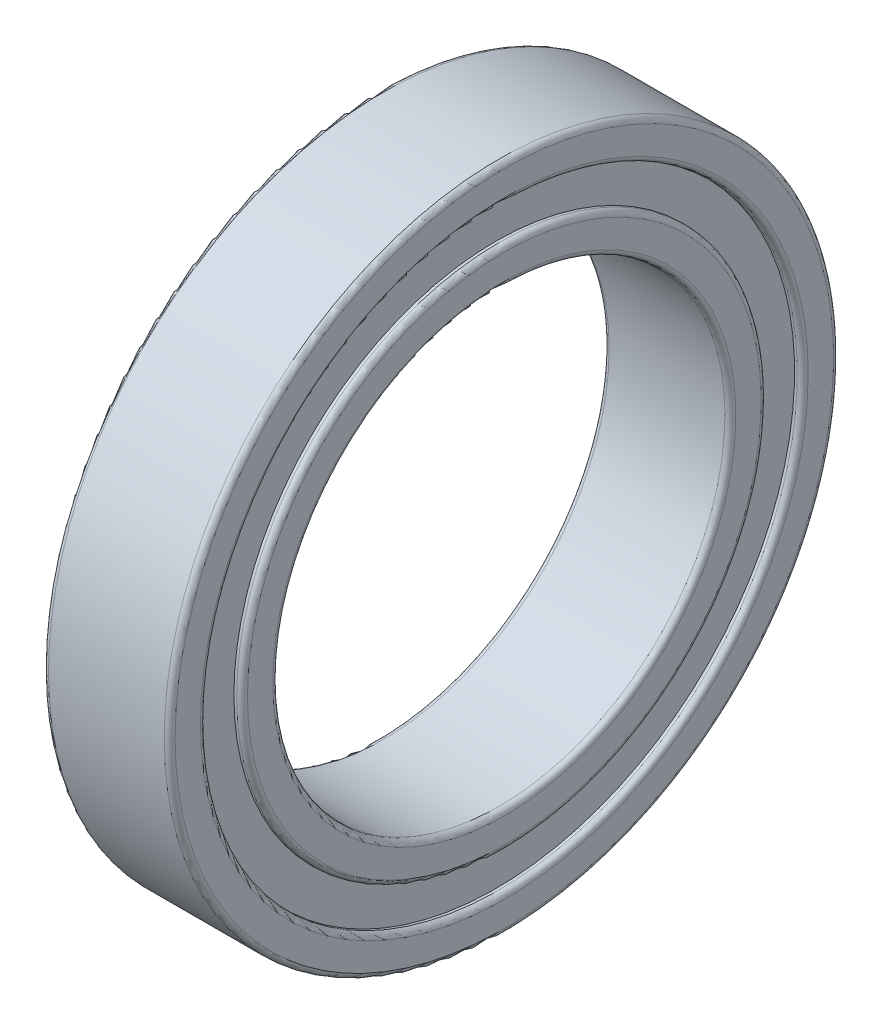
from build123d import *
from build123d.topology import SkipClean

# Parameters (mm, degrees)
SKETCH_5_W               = 0.8999999999999997
SKETCH_5_H               = 0.6000000000000014
PATTERN_CIRCULAR_5_COUNT = 26
PATTERN_CIRCULAR_2_COUNT = 26
SKETCH_8_W               = 0.30000000000000027
SKETCH_8_H               = 2.6000000000000014
SKETCH_8_W_2             = 0.2999999999999998


with BuildPart() as part:
    # 草图2 → 旋转1 (revolve)
    with BuildSketch(Plane.XY):
        with BuildLine():
            Line((3.2000000000000015, 12.500000000000004), (-3.2000000000000006, 12.500000000000004))
            ThreePointArc((-3.2000000000000006, 12.500000000000004), (-3.4121320343559653, 12.58786796564404), (-3.5000000000000013, 12.800000000000006))
            Line((-3.5000000000000013, 12.800000000000006), (-3.5000000000000013, 14.200000000000019))
            ThreePointArc((-3.5000000000000013, 14.200000000000019), (-3.412132034355964, 14.41213203435598), (-3.2000000000000015, 14.500000000000012))
            Line((-3.2000000000000015, 14.500000000000012), (-1.1180339887499022, 14.500000000000012))
            ThreePointArc((-1.1180339887499022, 14.500000000000012), (2.29e-15, 13.999999999999998), (1.1180339887499022, 14.500000000000012))
            Line((1.1180339887499022, 14.500000000000012), (3.2000000000000015, 14.500000000000012))
            ThreePointArc((3.2000000000000015, 14.500000000000012), (3.4121320343559667, 14.412132034355977), (3.500000000000003, 14.200000000000012))
            Line((3.500000000000003, 14.200000000000012), (3.500000000000003, 12.800000000000006))
            ThreePointArc((3.500000000000003, 12.800000000000006), (3.4121320343559676, 12.58786796564404), (3.2000000000000015, 12.500000000000004))
        make_face()
        with BuildLine():
            Line((-3.4999999999999996, 18.199999999999996), (-3.499999999999998, 16.799999999999997))
            ThreePointArc((-3.499999999999998, 16.799999999999997), (-3.412132034355961, 16.587867965644037), (-3.199999999999998, 16.5))
            Line((-3.199999999999998, 16.5), (-1.1180339887498894, 16.5))
            ThreePointArc((-1.1180339887498894, 16.5), (2.29e-15, 16.999999999999993), (1.1180339887498894, 16.5))
            Line((1.1180339887498894, 16.5), (3.1999999999999997, 16.5))
            ThreePointArc((3.1999999999999997, 16.5), (3.4121320343559645, 16.587867965644037), (3.5000000000000013, 16.8))
            Line((3.5000000000000013, 16.8), (3.5000000000000013, 18.2))
            ThreePointArc((3.5000000000000013, 18.2), (3.412132034355966, 18.412132034355963), (3.2000000000000015, 18.500000000000004))
            Line((3.2000000000000015, 18.500000000000004), (-3.1999999999999997, 18.500000000000004))
            ThreePointArc((-3.1999999999999997, 18.500000000000004), (-3.4121320343559676, 18.412132034355967), (-3.4999999999999996, 18.199999999999996))
        make_face()
    revolve(axis=Axis((-3.4999999999999996, 0, 0), (1, 0, 0)))


with BuildPart() as body_2:
    # 草图5 → 旋转3 (revolve)
    with BuildSketch(Plane.XY):
        with Locations((2.03e-15, 15.5)):
            Rectangle(SKETCH_5_W, SKETCH_5_H)
    revolve(axis=Axis((-19.927092192426834, 0, 0), (1, 0, 0)))



with BuildPart() as body_3:
    # 草图3 → 旋转2 (revolve)
    with BuildSketch(Plane.XY):
        with BuildLine():
            ThreePointArc((1.6499999999999924, 15.5), (-3.2e-16, 17.149999999999988), (-1.6499999999999928, 15.5))
            Line((-1.6499999999999935, 15.5), (1.6499999999999935, 15.5))
        make_face()
    revolve(axis=Axis((-1.6499999999999935, 15.5, 0), (1, 0, 0)))


with BuildPart() as pattern_circular_5_1:
    # 阵列(圆周)5: pattern copy
    add(body_3.part.rotate(Axis((-13.200000000000006, 0, 0), (1, 0, 0)), 1 * 360 / PATTERN_CIRCULAR_5_COUNT))


with BuildPart() as pattern_circular_5_2:
    # 阵列(圆周)5: pattern copy
    add(body_3.part.rotate(Axis((-13.200000000000006, 0, 0), (1, 0, 0)), 2 * 360 / PATTERN_CIRCULAR_5_COUNT))


with BuildPart() as pattern_circular_5_3:
    # 阵列(圆周)5: pattern copy
    add(body_3.part.rotate(Axis((-13.200000000000006, 0, 0), (1, 0, 0)), 3 * 360 / PATTERN_CIRCULAR_5_COUNT))


with BuildPart() as pattern_circular_5_4:
    # 阵列(圆周)5: pattern copy
    add(body_3.part.rotate(Axis((-13.200000000000006, 0, 0), (1, 0, 0)), 4 * 360 / PATTERN_CIRCULAR_5_COUNT))


with BuildPart() as pattern_circular_5_5:
    # 阵列(圆周)5: pattern copy
    add(body_3.part.rotate(Axis((-13.200000000000006, 0, 0), (1, 0, 0)), 5 * 360 / PATTERN_CIRCULAR_5_COUNT))


with BuildPart() as pattern_circular_5_6:
    # 阵列(圆周)5: pattern copy
    add(body_3.part.rotate(Axis((-13.200000000000006, 0, 0), (1, 0, 0)), 6 * 360 / PATTERN_CIRCULAR_5_COUNT))


with BuildPart() as pattern_circular_5_7:
    # 阵列(圆周)5: pattern copy
    add(body_3.part.rotate(Axis((-13.200000000000006, 0, 0), (1, 0, 0)), 7 * 360 / PATTERN_CIRCULAR_5_COUNT))


with BuildPart() as pattern_circular_5_8:
    # 阵列(圆周)5: pattern copy
    add(body_3.part.rotate(Axis((-13.200000000000006, 0, 0), (1, 0, 0)), 8 * 360 / PATTERN_CIRCULAR_5_COUNT))


with BuildPart() as pattern_circular_5_9:
    # 阵列(圆周)5: pattern copy
    add(body_3.part.rotate(Axis((-13.200000000000006, 0, 0), (1, 0, 0)), 9 * 360 / PATTERN_CIRCULAR_5_COUNT))


with BuildPart() as pattern_circular_5_10:
    # 阵列(圆周)5: pattern copy
    add(body_3.part.rotate(Axis((-13.200000000000006, 0, 0), (1, 0, 0)), 10 * 360 / PATTERN_CIRCULAR_5_COUNT))


with BuildPart() as pattern_circular_5_11:
    # 阵列(圆周)5: pattern copy
    add(body_3.part.rotate(Axis((-13.200000000000006, 0, 0), (1, 0, 0)), 11 * 360 / PATTERN_CIRCULAR_5_COUNT))


with BuildPart() as pattern_circular_5_12:
    # 阵列(圆周)5: pattern copy
    add(body_3.part.rotate(Axis((-13.200000000000006, 0, 0), (1, 0, 0)), 12 * 360 / PATTERN_CIRCULAR_5_COUNT))


with BuildPart() as pattern_circular_5_13:
    # 阵列(圆周)5: pattern copy
    add(body_3.part.rotate(Axis((-13.200000000000006, 0, 0), (1, 0, 0)), 13 * 360 / PATTERN_CIRCULAR_5_COUNT))


with BuildPart() as pattern_circular_5_14:
    # 阵列(圆周)5: pattern copy
    add(body_3.part.rotate(Axis((-13.200000000000006, 0, 0), (1, 0, 0)), 14 * 360 / PATTERN_CIRCULAR_5_COUNT))


with BuildPart() as pattern_circular_5_15:
    # 阵列(圆周)5: pattern copy
    add(body_3.part.rotate(Axis((-13.200000000000006, 0, 0), (1, 0, 0)), 15 * 360 / PATTERN_CIRCULAR_5_COUNT))


with BuildPart() as pattern_circular_5_16:
    # 阵列(圆周)5: pattern copy
    add(body_3.part.rotate(Axis((-13.200000000000006, 0, 0), (1, 0, 0)), 16 * 360 / PATTERN_CIRCULAR_5_COUNT))


with BuildPart() as pattern_circular_5_17:
    # 阵列(圆周)5: pattern copy
    add(body_3.part.rotate(Axis((-13.200000000000006, 0, 0), (1, 0, 0)), 17 * 360 / PATTERN_CIRCULAR_5_COUNT))


with BuildPart() as pattern_circular_5_18:
    # 阵列(圆周)5: pattern copy
    add(body_3.part.rotate(Axis((-13.200000000000006, 0, 0), (1, 0, 0)), 18 * 360 / PATTERN_CIRCULAR_5_COUNT))


with BuildPart() as pattern_circular_5_19:
    # 阵列(圆周)5: pattern copy
    add(body_3.part.rotate(Axis((-13.200000000000006, 0, 0), (1, 0, 0)), 19 * 360 / PATTERN_CIRCULAR_5_COUNT))


with BuildPart() as pattern_circular_5_20:
    # 阵列(圆周)5: pattern copy
    add(body_3.part.rotate(Axis((-13.200000000000006, 0, 0), (1, 0, 0)), 20 * 360 / PATTERN_CIRCULAR_5_COUNT))


with BuildPart() as pattern_circular_5_21:
    # 阵列(圆周)5: pattern copy
    add(body_3.part.rotate(Axis((-13.200000000000006, 0, 0), (1, 0, 0)), 21 * 360 / PATTERN_CIRCULAR_5_COUNT))


with BuildPart() as pattern_circular_5_22:
    # 阵列(圆周)5: pattern copy
    add(body_3.part.rotate(Axis((-13.200000000000006, 0, 0), (1, 0, 0)), 22 * 360 / PATTERN_CIRCULAR_5_COUNT))


with BuildPart() as pattern_circular_5_23:
    # 阵列(圆周)5: pattern copy
    add(body_3.part.rotate(Axis((-13.200000000000006, 0, 0), (1, 0, 0)), 23 * 360 / PATTERN_CIRCULAR_5_COUNT))


with BuildPart() as pattern_circular_5_24:
    # 阵列(圆周)5: pattern copy
    add(body_3.part.rotate(Axis((-13.200000000000006, 0, 0), (1, 0, 0)), 24 * 360 / PATTERN_CIRCULAR_5_COUNT))


with BuildPart() as pattern_circular_5_25:
    # 阵列(圆周)5: pattern copy
    add(body_3.part.rotate(Axis((-13.200000000000006, 0, 0), (1, 0, 0)), 25 * 360 / PATTERN_CIRCULAR_5_COUNT))


with BuildPart() as cut_revolve_1_tool:
    # 草图6 → 切除-旋转1 (revolve)
    with BuildSketch(Plane.XY):
        with BuildLine():
            Line((-1.6224980739587886, 15.8), (1.6224980739587886, 15.8))
            ThreePointArc((1.6224980739587886, 15.8), (4.83e-15, 17.149999999999988), (-1.6224980739587886, 15.8))
        make_face()
        with BuildLine():
            Line((-1.6224980739587886, 15.199999999999998), (1.6224980739587886, 15.199999999999998))
            ThreePointArc((1.6224980739587886, 15.199999999999998), (5.2e-15, 13.85), (-1.6224980739587886, 15.199999999999998))
        make_face()
    revolve(axis=Axis((-19.927092192426834, 0, 0), (1, 0, 0)))


with BuildPart() as part_1:
    add(part.part)

    # 切除-旋转1: cut by cut_revolve_1_tool
    add(cut_revolve_1_tool.part, mode=Mode.SUBTRACT)

    # 草图8 → 旋转5 (revolve)
    with BuildSketch(Plane.XY):
        with Locations((2.900000000000003, 15.5)):
            Rectangle(SKETCH_8_W, SKETCH_8_H)
        with Locations((-2.8999999999999884, 15.5)):
            Rectangle(SKETCH_8_W_2, SKETCH_8_H)
    revolve(axis=Axis((-19.927092192426834, 0, 0), (1, 0, 0)))


with BuildPart() as body_3_1:
    add(body_3.part)

    # 切除-旋转1: cut by cut_revolve_1_tool
    add(cut_revolve_1_tool.part, mode=Mode.SUBTRACT)


with BuildPart() as pattern_circular_5_1_1:
    add(pattern_circular_5_1.part)

    # 切除-旋转1: cut by cut_revolve_1_tool
    add(cut_revolve_1_tool.part, mode=Mode.SUBTRACT)


with BuildPart() as pattern_circular_5_2_1:
    add(pattern_circular_5_2.part)

    # 切除-旋转1: cut by cut_revolve_1_tool
    add(cut_revolve_1_tool.part, mode=Mode.SUBTRACT)


with BuildPart() as pattern_circular_5_3_1:
    add(pattern_circular_5_3.part)

    # 切除-旋转1: cut by cut_revolve_1_tool
    add(cut_revolve_1_tool.part, mode=Mode.SUBTRACT)


with BuildPart() as pattern_circular_5_4_1:
    add(pattern_circular_5_4.part)

    # 切除-旋转1: cut by cut_revolve_1_tool
    add(cut_revolve_1_tool.part, mode=Mode.SUBTRACT)


with BuildPart() as pattern_circular_5_5_1:
    add(pattern_circular_5_5.part)

    # 切除-旋转1: cut by cut_revolve_1_tool
    add(cut_revolve_1_tool.part, mode=Mode.SUBTRACT)


with BuildPart() as pattern_circular_5_6_1:
    add(pattern_circular_5_6.part)

    # 切除-旋转1: cut by cut_revolve_1_tool
    add(cut_revolve_1_tool.part, mode=Mode.SUBTRACT)


with BuildPart() as pattern_circular_5_7_1:
    add(pattern_circular_5_7.part)

    # 切除-旋转1: cut by cut_revolve_1_tool
    add(cut_revolve_1_tool.part, mode=Mode.SUBTRACT)


with BuildPart() as pattern_circular_5_8_1:
    add(pattern_circular_5_8.part)

    # 切除-旋转1: cut by cut_revolve_1_tool
    add(cut_revolve_1_tool.part, mode=Mode.SUBTRACT)


with BuildPart() as pattern_circular_5_9_1:
    add(pattern_circular_5_9.part)

    # 切除-旋转1: cut by cut_revolve_1_tool
    add(cut_revolve_1_tool.part, mode=Mode.SUBTRACT)


with BuildPart() as pattern_circular_5_10_1:
    add(pattern_circular_5_10.part)

    # 切除-旋转1: cut by cut_revolve_1_tool
    add(cut_revolve_1_tool.part, mode=Mode.SUBTRACT)


with BuildPart() as pattern_circular_5_11_1:
    add(pattern_circular_5_11.part)

    # 切除-旋转1: cut by cut_revolve_1_tool
    add(cut_revolve_1_tool.part, mode=Mode.SUBTRACT)


with BuildPart() as pattern_circular_5_12_1:
    add(pattern_circular_5_12.part)

    # 切除-旋转1: cut by cut_revolve_1_tool
    add(cut_revolve_1_tool.part, mode=Mode.SUBTRACT)


with BuildPart() as pattern_circular_5_13_1:
    add(pattern_circular_5_13.part)

    # 切除-旋转1: cut by cut_revolve_1_tool
    add(cut_revolve_1_tool.part, mode=Mode.SUBTRACT)


with BuildPart() as pattern_circular_5_14_1:
    add(pattern_circular_5_14.part)

    # 切除-旋转1: cut by cut_revolve_1_tool
    add(cut_revolve_1_tool.part, mode=Mode.SUBTRACT)


with BuildPart() as pattern_circular_5_15_1:
    add(pattern_circular_5_15.part)

    # 切除-旋转1: cut by cut_revolve_1_tool
    add(cut_revolve_1_tool.part, mode=Mode.SUBTRACT)


with BuildPart() as pattern_circular_5_16_1:
    add(pattern_circular_5_16.part)

    # 切除-旋转1: cut by cut_revolve_1_tool
    add(cut_revolve_1_tool.part, mode=Mode.SUBTRACT)


with BuildPart() as pattern_circular_5_17_1:
    add(pattern_circular_5_17.part)

    # 切除-旋转1: cut by cut_revolve_1_tool
    add(cut_revolve_1_tool.part, mode=Mode.SUBTRACT)


with BuildPart() as pattern_circular_5_18_1:
    add(pattern_circular_5_18.part)

    # 切除-旋转1: cut by cut_revolve_1_tool
    add(cut_revolve_1_tool.part, mode=Mode.SUBTRACT)


with BuildPart() as pattern_circular_5_19_1:
    add(pattern_circular_5_19.part)

    # 切除-旋转1: cut by cut_revolve_1_tool
    add(cut_revolve_1_tool.part, mode=Mode.SUBTRACT)


with BuildPart() as pattern_circular_5_20_1:
    add(pattern_circular_5_20.part)

    # 切除-旋转1: cut by cut_revolve_1_tool
    add(cut_revolve_1_tool.part, mode=Mode.SUBTRACT)


with BuildPart() as pattern_circular_5_21_1:
    add(pattern_circular_5_21.part)

    # 切除-旋转1: cut by cut_revolve_1_tool
    add(cut_revolve_1_tool.part, mode=Mode.SUBTRACT)


with BuildPart() as pattern_circular_5_22_1:
    add(pattern_circular_5_22.part)

    # 切除-旋转1: cut by cut_revolve_1_tool
    add(cut_revolve_1_tool.part, mode=Mode.SUBTRACT)


with BuildPart() as pattern_circular_5_23_1:
    add(pattern_circular_5_23.part)

    # 切除-旋转1: cut by cut_revolve_1_tool
    add(cut_revolve_1_tool.part, mode=Mode.SUBTRACT)


with BuildPart() as pattern_circular_5_24_1:
    add(pattern_circular_5_24.part)

    # 切除-旋转1: cut by cut_revolve_1_tool
    add(cut_revolve_1_tool.part, mode=Mode.SUBTRACT)


with BuildPart() as pattern_circular_5_25_1:
    add(pattern_circular_5_25.part)

    # 切除-旋转1: cut by cut_revolve_1_tool
    add(cut_revolve_1_tool.part, mode=Mode.SUBTRACT)


with BuildPart() as body_2_1:
    with SkipClean():  # the faces are left unmerged after this step: merging them gives an invalid solid
        add(body_2.part)

        add(body_3_1.part)  # 旋转4 merges body 3
        # 草图7 → 旋转4 (revolve)
        with BuildSketch(Plane.XY):
            with BuildLine():
                Line((-1.4999999999999953, 15.5), (1.4999999999999953, 15.5))
                ThreePointArc((1.4999999999999953, 15.5), (6.29e-15, 16.99999999999999), (-1.4999999999999953, 15.5))
            make_face()
        revolve_4 = revolve(axis=Axis((-1.4999999999999953, 15.5, 0), (1, 0, 0)))

    # 阵列(圆周)2: 旋转4 ×26 about axis
    with SkipClean():  # the faces are left unmerged after this step: merging them gives an invalid solid
        pattern_circular_2_axis = Axis((-13.200000000000006, 0, 0), (1, 0, 0))
        for i in range(1, PATTERN_CIRCULAR_2_COUNT):
            add(revolve_4.rotate(pattern_circular_2_axis, i * 360 / PATTERN_CIRCULAR_2_COUNT))


solid = Compound([part_1.part, pattern_circular_5_1_1.part, pattern_circular_5_2_1.part, pattern_circular_5_3_1.part, pattern_circular_5_4_1.part, pattern_circular_5_5_1.part, pattern_circular_5_6_1.part, pattern_circular_5_7_1.part, pattern_circular_5_8_1.part, pattern_circular_5_9_1.part, pattern_circular_5_10_1.part, pattern_circular_5_11_1.part, pattern_circular_5_12_1.part, pattern_circular_5_13_1.part, pattern_circular_5_14_1.part, pattern_circular_5_15_1.part, pattern_circular_5_16_1.part, pattern_circular_5_17_1.part, pattern_circular_5_18_1.part, pattern_circular_5_19_1.part, pattern_circular_5_20_1.part, pattern_circular_5_21_1.part, pattern_circular_5_22_1.part, pattern_circular_5_23_1.part, pattern_circular_5_24_1.part, pattern_circular_5_25_1.part, body_2_1.part])
